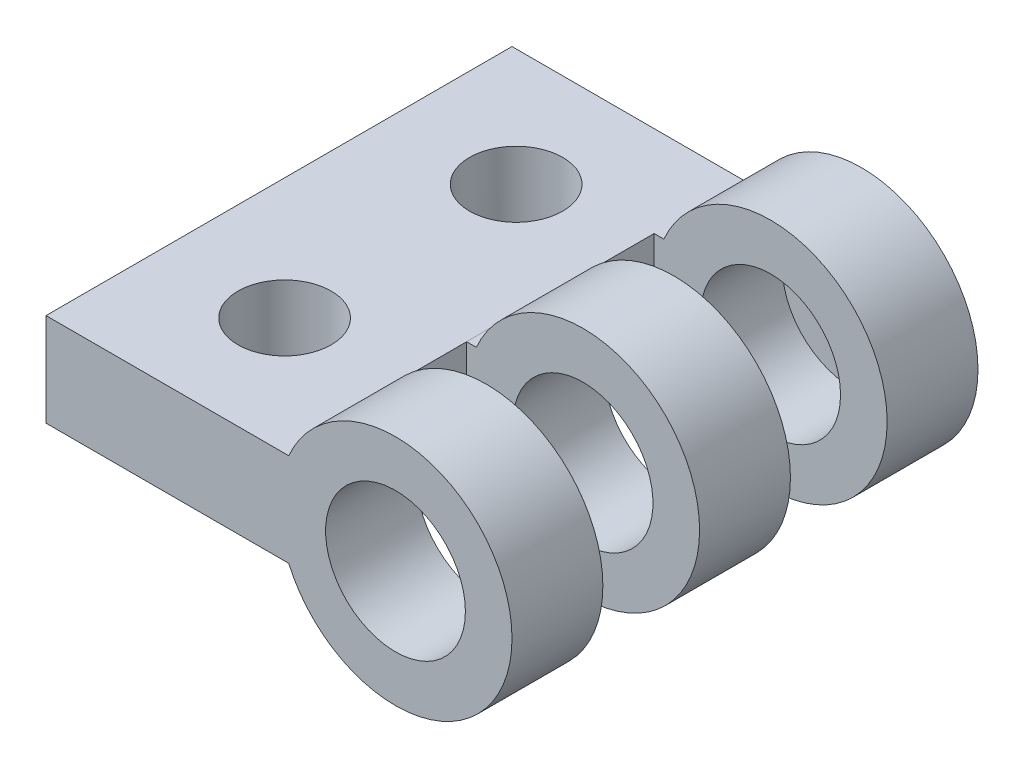
from build123d import *

# Parameters (mm, degrees)
SKETCH1_R                = 2.5
SKETCH1_R_2              = 1.5
BOSS_EXTRUDE2_DEPTH      = 1.95
BOSS_EXTRUDE3_DEPTH      = 1
BOSS_EXTRUDE3_DEPTH_BACK = 1
SKETCH7_W                = 5
SKETCH7_H                = 10
BOSS_EXTRUDE4_REACH      = 13.456
BOSS_EXTRUDE4_END_RADIUS = 2.5
SKETCH8_W                = 1.95
SKETCH8_H                = 2
SKETCH10_R               = 2.5
SKETCH10_R_2             = 1.5
BOSS_EXTRUDE5_DEPTH      = 1.95
BOSS_EXTRUDE6_DEPTH      = 0.975
BOSS_EXTRUDE6_DEPTH_BACK = 0.975
SKETCH12_R               = 2.5
SKETCH12_R_2             = 1.5
BOSS_EXTRUDE7_REACH      = 13.456
BOSS_EXTRUDE7_END_RADIUS = 2.5
SKETCH13_W               = 1.95
SKETCH13_H               = 2.002875352
SKETCH13_H_2             = 2
BOSS_EXTRUDE8_START      = -0.2
SKETCH15_R               = 1.5
BOSS_EXTRUDE8_DEPTH      = 0.2
SKETCH16_R               = 1
CUT_EXTRUDE1_DEPTH       = 10


with BuildPart() as part:
    # Sketch1 → Boss-Extrude2 (new body)
    with BuildSketch(Plane.XY):
        Circle(SKETCH1_R)
        Circle(SKETCH1_R_2, mode=Mode.SUBTRACT)
    extrude(amount=BOSS_EXTRUDE2_DEPTH)



with BuildPart() as body_2:
    # Sketch7 → Boss-Extrude3 (new, two sides: drawn at the far end of the back side and taken through both)
    with BuildSketch(Plane(origin=(0, 0, 0), x_dir=(1, 0, 0), z_dir=(0, 1, 0)).offset(-BOSS_EXTRUDE3_DEPTH_BACK)):
        with Locations((-5, -5)):
            Rectangle(SKETCH7_W, SKETCH7_H)
    extrude(amount=BOSS_EXTRUDE3_DEPTH + BOSS_EXTRUDE3_DEPTH_BACK)


with BuildPart() as part_1:
    add(part.part)

    add(body_2.part)  # Boss-Extrude4 merges body 2
    # Boss-Extrude4: up to this cylinder (the profile starts outside it)
    boss_extrude4_end = Plane(origin=(0, 0, 0.975), z_dir=(0, 0, -1)) * Cylinder(BOSS_EXTRUDE4_END_RADIUS, 32.912, mode=Mode.PRIVATE)
    # Sketch8 → Boss-Extrude4 (add, up to the surface)
    with BuildSketch(Plane(origin=(-2.5, 0, 0), x_dir=(0, 0, -1), z_dir=(1, 0, 0)), mode=Mode.PRIVATE) as boss_extrude4_sk1:
        with Locations((-0.975, 0)):
            Rectangle(SKETCH8_W, SKETCH8_H)
    boss_extrude4_tool1 = extrude(boss_extrude4_sk1.sketch, amount=BOSS_EXTRUDE4_REACH, mode=Mode.PRIVATE) - boss_extrude4_end
    add(boss_extrude4_tool1.solids().sort_by_distance((-2.5, 0, 0.975))[0])
    add(boss_extrude4_tool1.solids().sort_by_distance((-2.5, 0, 0.975))[1])



with BuildPart() as body_2_2:
    # Sketch10 → Boss-Extrude5 (new body)
    with BuildSketch(Plane.XY.offset(10)):
        Circle(SKETCH10_R)
        Circle(SKETCH10_R_2, mode=Mode.SUBTRACT)
    extrude(amount=-BOSS_EXTRUDE5_DEPTH)


with BuildPart() as body_3:
    # Sketch12 → Boss-Extrude6 (new, two sides: drawn at the far end of the back side and taken through both)
    with BuildSketch(Plane.YX.offset(-5).offset(-BOSS_EXTRUDE6_DEPTH_BACK)):
        Circle(SKETCH12_R)
        Circle(SKETCH12_R_2, mode=Mode.SUBTRACT)
    extrude(amount=BOSS_EXTRUDE6_DEPTH + BOSS_EXTRUDE6_DEPTH_BACK)


with BuildPart() as part_2:
    add(part_1.part)

    add(body_2_2.part)  # Boss-Extrude7 merges body 2 2

    add(body_3.part)  # Boss-Extrude7 merges body 3
    # Boss-Extrude7: up to this cylinder (the profile starts outside it)
    boss_extrude7_end = Plane(origin=(0, 0, 7.0125), z_dir=(0, 0, 1)) * Cylinder(BOSS_EXTRUDE7_END_RADIUS, 36.937, mode=Mode.PRIVATE)
    # Sketch13 → Boss-Extrude7 (add, up to the surface)
    with BuildSketch(Plane(origin=(-2.5, 0, 0), x_dir=(0, 0, -1), z_dir=(1, 0, 0)), mode=Mode.PRIVATE) as boss_extrude7_sk1:
        with Locations((-5, 0.001437676)):
            Rectangle(SKETCH13_W, SKETCH13_H)
    boss_extrude7_tool1 = extrude(boss_extrude7_sk1.sketch, amount=BOSS_EXTRUDE7_REACH, mode=Mode.PRIVATE) - boss_extrude7_end
    add(boss_extrude7_tool1.solids().sort_by_distance((-2.5, 0.001438, 5))[0])
    add(boss_extrude7_tool1.solids().sort_by_distance((-2.5, 0.001438, 5))[1])
    # Sketch13 → Boss-Extrude7 (add, up to the surface)
    with BuildSketch(Plane(origin=(-2.5, 0, 0), x_dir=(0, 0, -1), z_dir=(1, 0, 0)), mode=Mode.PRIVATE) as boss_extrude7_sk2:
        with Locations((-9.025, 0)):
            Rectangle(SKETCH13_W, SKETCH13_H_2)
    boss_extrude7_tool2 = extrude(boss_extrude7_sk2.sketch, amount=BOSS_EXTRUDE7_REACH, mode=Mode.PRIVATE) - boss_extrude7_end
    add(boss_extrude7_tool2.solids().sort_by_distance((-2.5, 0, 9.025))[0])
    add(boss_extrude7_tool2.solids().sort_by_distance((-2.5, 0, 9.025))[1])

    # Sketch15 → Boss-Extrude8 (add)
    with BuildSketch(Plane(origin=(0, 0, 0), x_dir=(-1, 0, 0), z_dir=(0, 0, -1)).offset(BOSS_EXTRUDE8_START)):
        Circle(SKETCH15_R)
    extrude(amount=BOSS_EXTRUDE8_DEPTH)

    # Sketch16 → Cut-Extrude1 (cut)
    with BuildSketch(Plane(origin=(0, 1, 0), x_dir=(1, 0, 0), z_dir=(0, 1, 0))):
        with Locations((-4.895643924, -7.484223199)):
            Circle(SKETCH16_R)
        with Locations((-4.895643924, -2.515776801)):
            Circle(SKETCH16_R)
    extrude(amount=-CUT_EXTRUDE1_DEPTH, mode=Mode.SUBTRACT)


solid = part_2.part
